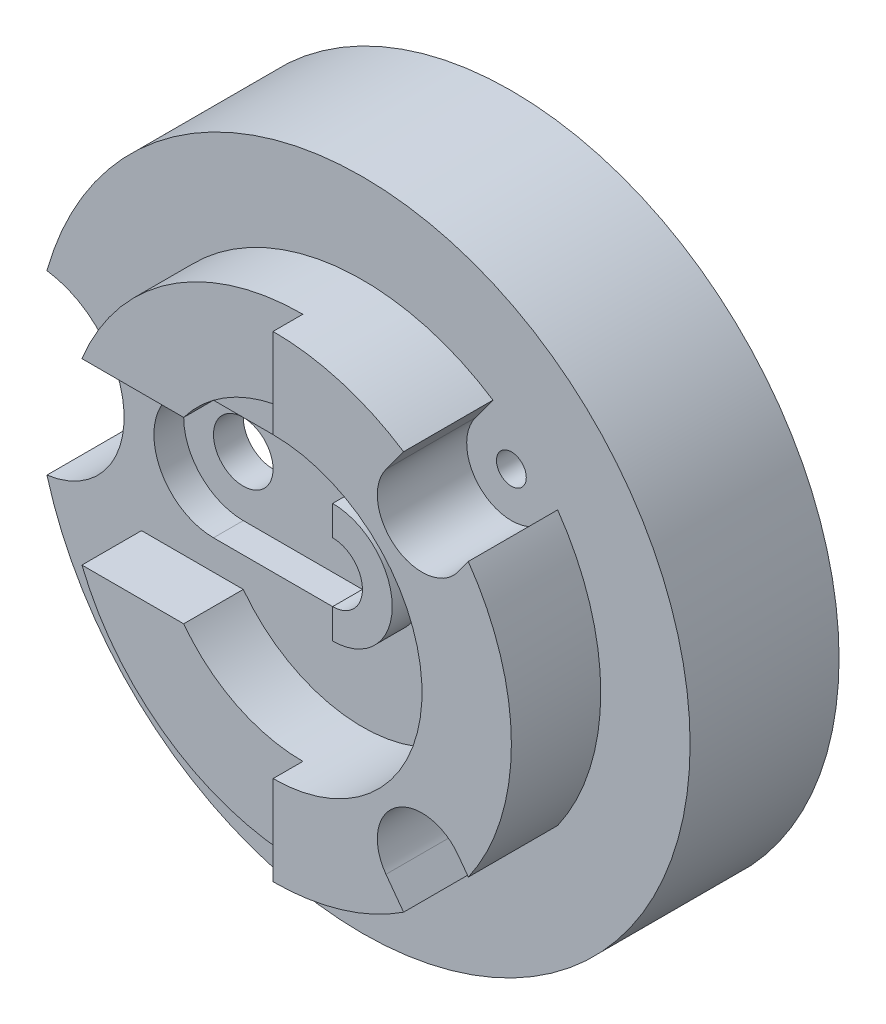
from build123d import *
from build123d.topology import SkipClean

# Parameters (mm, degrees)
SKETCH1_R           = 110
BOSS_EXTRUDE2_DEPTH = 50
SKETCH3_R           = 100
CUT_EXTRUDE1_DEPTH  = 30
SKETCH4_R           = 10
SKETCH4_R_2         = 5
CUT_EXTRUDE2_DEPTH  = 20
SKETCH5_R           = 10
CUT_EXTRUDE3_DEPTH  = 10
BOSS_EXTRUDE3_START = 20
BOSS_EXTRUDE3_DEPTH = 20
CUT_EXTRUDE6_START  = -30
CUT_EXTRUDE6_DEPTH  = 30
BOSS_EXTRUDE4_DEPTH = 20
BOSS_EXTRUDE5_DEPTH = 20
BOSS_EXTRUDE6_DEPTH = 30
CUT_EXTRUDE8_START  = -30
SKETCH11_R          = 5
CUT_EXTRUDE8_DEPTH  = 30
CUT_EXTRUDE9_START  = -50
SKETCH12_R          = 5
CUT_EXTRUDE9_DEPTH  = 50
CUT_EXTRUDE10_START = -50
SKETCH13_R          = 5
CUT_EXTRUDE10_DEPTH = 50


with BuildPart() as part:
    # Sketch1 → Boss-Extrude2 (new body)
    with BuildSketch(Plane.XY):
        Circle(SKETCH1_R)
    extrude(amount=BOSS_EXTRUDE2_DEPTH)

    # Sketch3 → Cut-Extrude1 (cut)
    with BuildSketch(Plane(origin=(0, 0, 0), x_dir=(-1, 0, 0), z_dir=(0, 0, -1))):
        Circle(SKETCH3_R)
    extrude(amount=-CUT_EXTRUDE1_DEPTH, mode=Mode.SUBTRACT)

    # Sketch4 → Cut-Extrude2 (cut)
    with BuildSketch(Plane.XY.offset(50)):
        Circle(SKETCH4_R)
        with Locations((-50, 0)):
            Circle(SKETCH4_R)
        with Locations((35, 0)):
            Circle(SKETCH4_R_2)
    extrude(amount=-CUT_EXTRUDE2_DEPTH, mode=Mode.SUBTRACT)

    # Sketch5 → Cut-Extrude3 (cut)
    with BuildSketch(Plane.XY.offset(50)):
        with BuildLine():
            Line((0, 20), (-50, 20))
            ThreePointArc((-50, 20), (-70, 0), (-50, -20))
            Line((-50, -20), (0, -20))
            ThreePointArc((0, -20), (20, 0), (0, 20))
        make_face()
        with Locations((-50, 0)):
            Circle(SKETCH5_R, mode=Mode.SUBTRACT)
        with BuildLine():
            ThreePointArc((10, 0), (-7.071067812, -7.071067812), (0, 10))
            ThreePointArc((0, 10), (7.071067812, 7.071067812), (10, 0))
        make_face(mode=Mode.SUBTRACT)
    extrude(amount=-CUT_EXTRUDE3_DEPTH, mode=Mode.SUBTRACT)

    # Sketch6 → Boss-Extrude3 (add)
    with BuildSketch(Plane.XY.offset(40).offset(BOSS_EXTRUDE3_START)):
        with BuildLine():
            Line((0, -10), (0, -20))
            ThreePointArc((0, -20), (20, 0), (0, 20))
            Line((0, 20), (0, 10))
            ThreePointArc((0, 10), (7.071067812, 7.071067812), (10, 0))
            ThreePointArc((10, 0), (7.071067812, -7.071067812), (0, -10))
        make_face()
    extrude(amount=-BOSS_EXTRUDE3_DEPTH)

    # Sketch7 → Cut-Extrude6 (cut)
    with BuildSketch(Plane.XY.offset(50).offset(CUT_EXTRUDE6_START)):
        with BuildLine():
            ThreePointArc((-105.909090909, -29.719765524), (-80, 0), (-105.909090909, 29.719765524))
            ThreePointArc((-105.909090909, 29.719765524), (-110, 0), (-105.909090909, -29.719765524))
        make_face()
    extrude(amount=CUT_EXTRUDE6_DEPTH, mode=Mode.SUBTRACT)

    # Sketch8 → Boss-Extrude4 (add)
    with BuildSketch(Plane.XY.offset(50)):
        with BuildLine():
            Line((0, 50), (0, 80))
            ThreePointArc((0, 80), (-44.72135955, 66.332495807), (-74.161984871, 30))
            Line((-74.161984871, 30), (-40, 30))
            ThreePointArc((-40, 30), (-22.360679775, 44.72135955), (0, 50))
        make_face()
    extrude(amount=BOSS_EXTRUDE4_DEPTH)

    # Sketch9 → Boss-Extrude5 (add)
    with BuildSketch(Plane.XY.offset(50)):
        with BuildLine():
            Line((0, -50), (0, -80))
            ThreePointArc((0, -80), (-44.72135955, -66.332495807), (-74.161984871, -30))
            Line((-74.161984871, -30), (-40, -30))
            ThreePointArc((-40, -30), (-22.360679775, -44.72135955), (0, -50))
        make_face()
    extrude(amount=BOSS_EXTRUDE5_DEPTH)

    # Sketch10 → Boss-Extrude6 (add)
    with SkipClean():  # the faces are left unmerged after this step: merging them gives an invalid solid
        with BuildSketch(Plane.XY.offset(50)):
            with BuildLine():
                Line((0, 80), (0, 50))
                ThreePointArc((0, 50), (50, 0), (0, -50))
                Line((0, -50), (0, -80))
                ThreePointArc((0, -80), (80, 0), (0, 80))
            make_face()
        extrude(amount=BOSS_EXTRUDE6_DEPTH)
    add(part.part.scale(1), mode=Mode.REPLACE)  # the faces are merged on a copy

    # Sketch11 → Cut-Extrude8 (cut)
    # profile 1 of 2: a face of its own
    with BuildSketch(Plane.XY.offset(80).offset(CUT_EXTRUDE8_START)):
        with BuildLine():
            ThreePointArc((43.816047842, -66.933952158), (55.693458652, -57.430293951), (65.557268925, -45.850239816))
            Line((65.557268925, -45.850239816), (62.096867875, -41.130626425))
            ThreePointArc((62.096867875, -41.130626425), (41.130626425, -37.903132125), (37.903132125, -58.869373575))
            Line((37.903132125, -58.869373575), (43.816047842, -66.933952158))
        make_face()
        with Locations((50, -50)):
            Circle(SKETCH11_R, mode=Mode.SUBTRACT)
    # profile 2 of 2: a face of its own
    with BuildSketch(Plane.XY.offset(80).offset(CUT_EXTRUDE8_START)):
        with BuildLine():
            Line((43.816047842, 66.933952158), (37.903132125, 58.869373575))
            ThreePointArc((37.903132125, 58.869373575), (40.679714776, 38.247030872), (61.392272116, 40.242124409))
            Line((61.392272116, 40.242124409), (65.531313117, 45.887329418))
            ThreePointArc((65.531313117, 45.887329418), (55.67720736, 57.446049304), (43.816047842, 66.933952158))
        make_face()
        with Locations((50, 50)):
            Circle(SKETCH11_R, mode=Mode.SUBTRACT)
    extrude(amount=CUT_EXTRUDE8_DEPTH, mode=Mode.SUBTRACT)

    # Sketch12 → Cut-Extrude9 (cut)
    with SkipClean():  # the faces are left unmerged after this step: merging them gives an invalid solid
        with BuildSketch(Plane.XY.offset(80).offset(CUT_EXTRUDE9_START)):
            with Locations((50, 50)):
                Circle(SKETCH12_R)
        extrude(amount=CUT_EXTRUDE9_DEPTH, mode=Mode.SUBTRACT)

    # Sketch13 → Cut-Extrude10 (cut)
    with SkipClean():  # the faces are left unmerged after this step: merging them gives an invalid solid
        with BuildSketch(Plane.XY.offset(80).offset(CUT_EXTRUDE10_START)):
            with Locations((50, -50)):
                Circle(SKETCH13_R)
        extrude(amount=CUT_EXTRUDE10_DEPTH, mode=Mode.SUBTRACT)


solid = part.part
